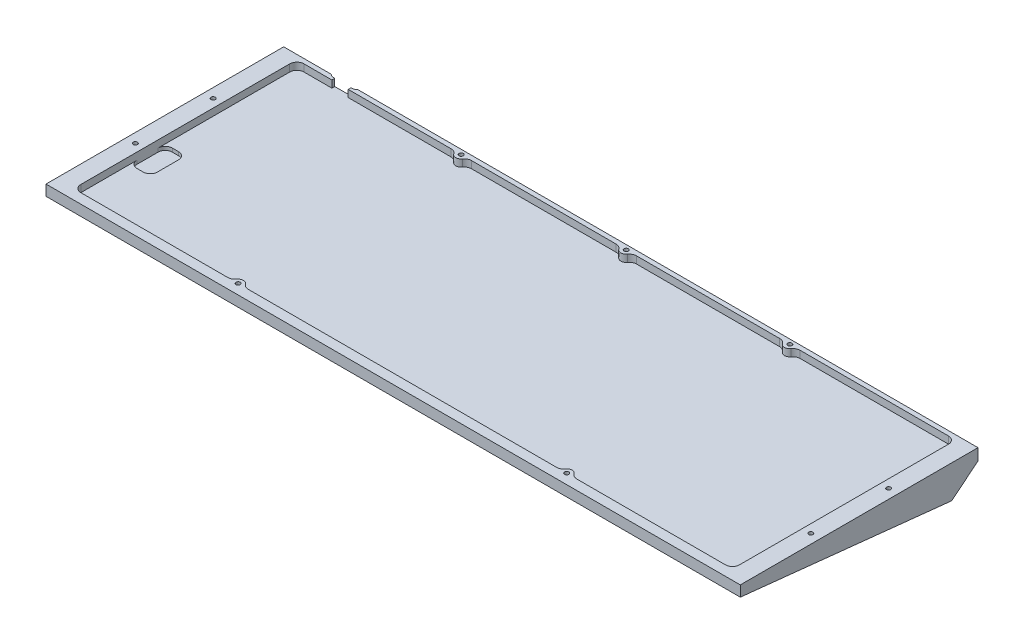
from build123d import *

# Parameters (mm, degrees)
SKETCH1_W               = 390.8
SKETCH1_H               = 133.8
BOSS_EXTRUDE1_DEPTH     = 6
SKETCH2_W               = 370.8
SKETCH2_H               = 125.6
CUT_EXTRUDE1_DEPTH      = 4
BOSS_EXTRUDE3_DEPTH     = 390.8
SKETCH8_W               = 9.2
SKETCH8_H               = 4
CUT_EXTRUDE2_DEPTH      = 10
BOSS_EXTRUDE4_DEPTH     = 4
SKETCH11_W              = 15.2
SKETCH11_H              = 5.5
CUT_EXTRUDE3_DEPTH      = 1
CUT_EXTRUDE6_DEPTH      = 414.309625425
CUT_EXTRUDE6_DEPTH_BACK = 414.309625425
M2_CLEARANCE_HOLE1_D    = 2.4
CUT_EXTRUDE7_START      = -3
SKETCH13_R              = 2.5
CUT_EXTRUDE7_DEPTH      = 411.484592101
FILLET2_R               = 4
SKETCH15_R              = 5
CUT_EXTRUDE8_DEPTH      = 1
SKETCH16_W              = 11.5
SKETCH16_H              = 19.9
CUT_EXTRUDE9_DEPTH      = 6
FILLET1_R               = 4


with BuildPart() as part:
    # Sketch1 → Boss-Extrude1 (new body)
    with BuildSketch(Plane(origin=(0, 0, 0), x_dir=(1, 0, 0), z_dir=(0, 1, 0))):
        with Locations((195.4, 66.9)):
            Rectangle(SKETCH1_W, SKETCH1_H)
    extrude(amount=BOSS_EXTRUDE1_DEPTH)

    # Sketch2 → Cut-Extrude1 (cut)
    with BuildSketch(Plane(origin=(0, 6, 0), x_dir=(1, 0, 0), z_dir=(0, 1, 0))):
        with Locations((195.4, 68.4)):
            Rectangle(SKETCH2_W, SKETCH2_H)
    extrude(amount=-CUT_EXTRUDE1_DEPTH, mode=Mode.SUBTRACT)

    # Boss-Extrude3: read off the stored shape, not the designer's step
    # Boss-Extrude3 outline → Boss-Extrude3 (add)
    with BuildSketch(Plane.YZ):
        Polygon((-14.062946679, -133.8), (0, -133.8), (0, 0), align=None)
    extrude(amount=BOSS_EXTRUDE3_DEPTH)

    # Sketch8 → Cut-Extrude2 (cut)
    with BuildSketch(Plane(origin=(0, 0, -133.8), x_dir=(-1, 0, 0), z_dir=(0, 0, -1))):
        with Locations((-34.3, 4)):
            Rectangle(SKETCH8_W, SKETCH8_H)
    extrude(amount=-CUT_EXTRUDE2_DEPTH, mode=Mode.SUBTRACT)

    # Sketch10 → Boss-Extrude4 (add)
    with BuildSketch(Plane(origin=(0, 2, 0), x_dir=(1, 0, 0), z_dir=(0, 1, 0))):
        with BuildLine():
            Line((99.5, 5.6), (105.5, 5.6))
            ThreePointArc((105.5, 5.6), (102.5, 8.6), (99.5, 5.6))
        make_face()
        with BuildLine():
            ThreePointArc((290.5, 5.6), (287.5, 8.6), (284.5, 5.6))
            Line((284.5, 5.6), (290.5, 5.6))
        make_face()
        with BuildLine():
            ThreePointArc((284.5, 131.2), (287.5, 128.2), (290.5, 131.2))
            Line((290.5, 131.2), (284.5, 131.2))
        make_face()
        with BuildLine():
            ThreePointArc((192.4, 131.2), (195.4, 128.2), (198.4, 131.2))
            Line((198.4, 131.2), (192.4, 131.2))
        make_face()
        with BuildLine():
            Line((105.5, 131.2), (99.5, 131.2))
            ThreePointArc((99.5, 131.2), (102.5, 128.2), (105.5, 131.2))
        make_face()
    extrude(amount=BOSS_EXTRUDE4_DEPTH)

    # Sketch11 → Cut-Extrude3 (cut)
    with BuildSketch(Plane(origin=(0, 0, -133.8), x_dir=(-1, 0, 0), z_dir=(0, 0, -1))):
        with Locations((-34.3, 3.25)):
            Rectangle(SKETCH11_W, SKETCH11_H)
    extrude(amount=-CUT_EXTRUDE3_DEPTH, mode=Mode.SUBTRACT)

    # Sketch12 → Cut-Extrude6 (cut, two sides: drawn at the far end of the back side and taken through both)
    with BuildSketch(Plane.ZY.offset(-CUT_EXTRUDE6_DEPTH_BACK)):
        Polygon((-133.8, -14.062946679), (-118.975297196, -12.504807627), (-133.8, -0.5), align=None)
    extrude(amount=CUT_EXTRUDE6_DEPTH + CUT_EXTRUDE6_DEPTH_BACK, mode=Mode.SUBTRACT)

    # M2 Clearance Hole1 (through all)
    with Locations(Plane(origin=(102.5, 6, -5.6), x_dir=(0, 0, 1), z_dir=(0, 1, 0))):
        with Locations((0, 0), (-39.4, -97.2), (-83.2, -97.2), (-125.6, 0), (-125.6, 92.9), (-125.6, 185), (-83.2, 283), (-39.4, 283), (0, 185)):
            Hole(M2_CLEARANCE_HOLE1_D / 2)

    # Sketch13 → Cut-Extrude7 (cut, through all)
    with BuildSketch(Plane(origin=(0, 6, 0), x_dir=(1, 0, 0), z_dir=(0, 1, 0)).offset(CUT_EXTRUDE7_START)):
        with Locations(Location((5.3, 45, 0), (0, 0, 270))):
            Circle(SKETCH13_R)
        with Locations(Location((5.3, 88.8, 0), (0, 0, 270))):
            Circle(SKETCH13_R)
        with Locations(Location((102.5, 5.6, 0), (0, 0, 270))):
            Circle(SKETCH13_R)
        with Locations(Location((287.5, 5.6, 0), (0, 0, 270))):
            Circle(SKETCH13_R)
        with Locations(Location((385.5, 45, 0), (0, 0, 270))):
            Circle(SKETCH13_R)
        with Locations(Location((385.5, 88.8, 0), (0, 0, 270))):
            Circle(SKETCH13_R)
        with Locations(Location((287.5, 131.2, 0), (0, 0, 270))):
            Circle(SKETCH13_R)
        with Locations(Location((195.4, 131.2, 0), (0, 0, 270))):
            Circle(SKETCH13_R)
        with Locations(Location((102.5, 131.2, 0), (0, 0, 270))):
            Circle(SKETCH13_R)
    extrude(amount=-CUT_EXTRUDE7_DEPTH, mode=Mode.SUBTRACT)

    # Fillet2
    # the kernel refuses this fillet: 4 mm, written as the material it adds along each edge
    with BuildSketch(Plane(origin=(41.9, 0.5, -132.8), x_dir=(-1, 0, 0), z_dir=(0, 1, 0))) as fillet2_piece_1:
        with BuildLine():
            CenterArc((2.645751311, -4), FILLET2_R, 90, 41.409622109)
            Line((0, -1), (0, 0))
            Line((0, 0), (2.645751311, 0))
        make_face()
    extrude(amount=5.5)
    with BuildSketch(Plane(origin=(26.7, 6, -132.8), x_dir=(0, 0, -1), z_dir=(0, -1, 0))) as fillet2_piece_2:
        with BuildLine():
            CenterArc((4, 2.645751311), FILLET2_R, 180, 41.409622109)
            Line((0, 2.645751311), (0, 0))
            Line((0, 0), (1, 0))
        make_face()
    extrude(amount=5.5)

    # Sketch15 → Cut-Extrude8 (cut)
    with BuildSketch(Plane(origin=(0, 0, 0), x_dir=(1, 0, 0), z_dir=(0, -0.9945218953682742, 0.10452846326764666))):
        with Locations(Location((15, -109.630646394, 0), (0, 0, 270))):
            Circle(SKETCH15_R)
        with Locations(Location((375.8, -109.630646394, 0), (0, 0, 270))):
            Circle(SKETCH15_R)
        with Locations(Location((15, -10, 0), (0, 0, 270))):
            Circle(SKETCH15_R)
        with Locations(Location((375.8, -10, 0), (0, 0, 270))):
            Circle(SKETCH15_R)
    extrude(amount=-CUT_EXTRUDE8_DEPTH, mode=Mode.SUBTRACT)

    # Sketch16 → Cut-Extrude9 (cut)
    with BuildSketch(Plane(origin=(0, 6, 0), x_dir=(1, 0, 0), z_dir=(0, 1, 0))):
        with Locations((15.75, 47.15)):
            Rectangle(SKETCH16_W, SKETCH16_H)
    extrude(amount=-CUT_EXTRUDE9_DEPTH, mode=Mode.SUBTRACT)

    # Fillet1
    fillet1_edges = [part.edges().sort_by_distance(p)[0] for p in [
        (10, 4, -5.6),
        (10, 4, -131.2),
        (380.8, 4, -131.2),
        (380.8, 4, -5.6),
        (10, 1, -37.2),
        (10, 1, -57.1),
        (21.5, 1, -57.1),
        (21.5, 1, -37.2),
        (99.5, 4, -131.2),
        (105.5, 4, -131.2),
        (192.4, 4, -131.2),
        (198.4, 4, -131.2),
        (284.5, 4, -131.2),
        (290.5, 4, -131.2),
        (290.5, 4, -5.6),
        (284.5, 4, -5.6),
        (105.5, 4, -5.6),
        (99.5, 4, -5.6),
    ]]
    fillet(fillet1_edges, radius=FILLET1_R)


solid = part.part
